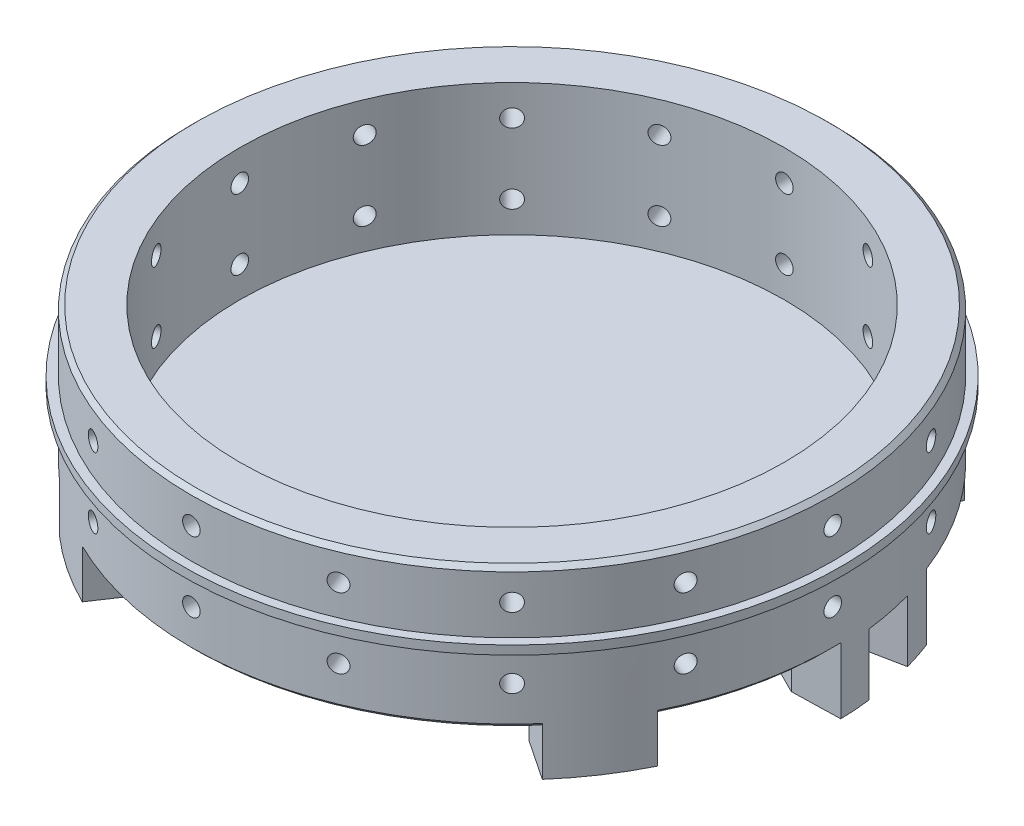
from build123d import *
from build123d.topology import SkipClean

# Parameters (mm, degrees)
RIPETIZIONECIRCOLARE7_COUNT = 16
CIRPATTERN1_COUNT           = 16
SKETCH7_R                   = 62
CUT_EXTRUDE4_DEPTH          = 108.266024459
BOSS_EXTRUDE20_START        = 2
SKETCH8_R                   = 73
BOSS_EXTRUDE20_DEPTH        = 2
BOSS_EXTRUDE19_START        = 14
BOSS_EXTRUDE19_DEPTH        = 14
CUT_EXTRUDE3_DEPTH          = 14
CIRPATTERN2_COUNT           = 2
BOSS_EXTRUDE21_START        = 10
BOSS_EXTRUDE21_DEPTH        = 10
CIRPATTERN3_COUNT           = 4
SMUSSO3_SIZE                = 1
CHAMFER1_SIZE               = 1


with BuildPart() as part:
    # Schizzo1 → Rivoluzione1 (revolve)
    with BuildSketch(Plane.XY, mode=Mode.PRIVATE) as rivoluzione1_sk:
        Polygon((-62, 30), (-73, 30), (-73, 16), (-75, 16), (-75, 14), (-73, 14), (-73, 0), (-62, 0), (-62, 14), (0, 14), (0, 16), (-62, 16), align=None)
    revolve(rivoluzione1_sk.sketch.rotate(Axis((0, 0, 0), (0, 1, 0)), 270), axis=Axis((0, 0, 0), (0, 1, 0)))

    # Schizzo5 → Ø4.0 (4) Diameter Hole1 (revolve, cut)
    with BuildSketch(Plane(origin=(-73, 23, 0), x_dir=(0, 0, 1), z_dir=(0, 1, 0))):
        Polygon((0, 0), (0, 19), (2, 17.798278762), (2, 0), align=None)
    f_4_0_4_diameter_hole1 = revolve(axis=Axis((-79.35, 23, 0), (1, 0, 0)), mode=Mode.SUBTRACT)

    # Schizzo9 → Foro Ø4.0 (4)-3 (revolve, cut)
    with BuildSketch(Plane(origin=(73, 7, 0), x_dir=(0, 0, -1), z_dir=(0, 1, 0))):
        Polygon((0, 0), (0, 19), (2, 17.798278762), (2, 0), align=None)
    foro_4_0_4_3 = revolve(axis=Axis((79.35, 7, 0), (-1, 0, 0)), mode=Mode.SUBTRACT)

    # RipetizioneCircolare7: Foro Ø4.0 (4)-3 ×16 about axis
    ripetizionecircolare7_axis = Axis((0, 14, 0), (0, -1, 0))
    for i in range(1, RIPETIZIONECIRCOLARE7_COUNT):
        add(foro_4_0_4_3.rotate(ripetizionecircolare7_axis, i * 360 / RIPETIZIONECIRCOLARE7_COUNT), mode=Mode.SUBTRACT)

    # CirPattern1: Ø4.0 (4) Diameter Hole1 ×16 about axis
    cirpattern1_axis = Axis((0, 16, 0), (0, -1, 0))
    for i in range(1, CIRPATTERN1_COUNT):
        add(f_4_0_4_diameter_hole1.rotate(cirpattern1_axis, i * 360 / CIRPATTERN1_COUNT), mode=Mode.SUBTRACT)

    # Sketch7 → Cut-Extrude4 (cut, through all)
    with BuildSketch(Plane.XZ.offset(-14)):
        with Locations(Location((0, 0, 0), (0, 0, 270))):
            Circle(SKETCH7_R)
    extrude(amount=-CUT_EXTRUDE4_DEPTH, mode=Mode.SUBTRACT)

    # Sketch8 → Boss-Extrude20 (add)
    with BuildSketch(Plane.XZ.offset(BOSS_EXTRUDE20_START)):
        with Locations(Location((0, 0, 0), (0, 0, 270))):
            Circle(SKETCH8_R)
    extrude(amount=-BOSS_EXTRUDE20_DEPTH)

    # Sketch6 → Boss-Extrude19 (add)
    with SkipClean():  # the faces are left unmerged after this step: merging them gives an invalid solid
        with BuildSketch(Plane.XZ.offset(2).offset(BOSS_EXTRUDE19_START)):
            with BuildLine():
                Line((-72.976985448, 1.832919783), (-61.980453394, 1.556726391))
                Line((-61.980453394, 1.556726391), (-53.695669228, 5.701108242))
                ThreePointArc((-53.695669228, 5.701108242), (-52.959930681, 10.534385188), (-51.790049455, 15.281305786))
                Line((-51.790049455, 15.281305786), (-57.858205705, 22.280664994))
                Line((-57.858205705, 22.280664994), (-68.123371233, 26.233686203))
                ThreePointArc((-68.123371233, 26.233686203), (-71.597325469, 14.241593507), (-72.976985448, 1.832919783))
            make_face()
        boss_extrude19 = extrude(amount=-BOSS_EXTRUDE19_DEPTH)

    # Sketch3 → Cut-Extrude3 (cut)
    with SkipClean():  # the faces are left unmerged after this step: merging them gives an invalid solid
        with BuildSketch(Plane.XZ.offset(16)):
            with BuildLine():
                Line((-61.555918543, 7.036415348), (-59.562972824, 17.055630068))
                Line((-59.562972824, 17.055630068), (-59.955820303, 17.643567869))
                Line((-59.955820303, 17.643567869), (-70.291743966, 19.699510914))
                ThreePointArc((-70.291743966, 19.699510914), (-71.597325469, 14.241593507), (-72.479780007, 8.699510914))
                Line((-72.479780007, 8.699510914), (-62.143856344, 6.643567869))
                Line((-62.143856344, 6.643567869), (-61.555918543, 7.036415348))
            make_face()
        cut_extrude3 = extrude(amount=-CUT_EXTRUDE3_DEPTH, mode=Mode.SUBTRACT)

    # Sketch4 → Ø4.0 (4) Diameter Hole3 (revolve, cut)
    with SkipClean():  # the faces are left unmerged after this step: merging them gives an invalid solid
        with BuildSketch(Plane(origin=(-60.559445683, -9, 12.046022708), x_dir=(0.19509032201612725, 0, 0.9807852804032307), z_dir=(0, 1, 0))):
            Polygon((0, 0), (0, 19), (2, 17.798278762), (2, 0), align=None)
        f_4_0_4_diameter_hole3 = revolve(axis=Axis((-66.787432214, -9, 13.284846253), (0.9807852804032307, 0, -0.19509032201612722)), mode=Mode.SUBTRACT)

    # CirPattern2: Boss-Extrude19, Cut-Extrude3, Ø4.0 (4) Diameter Hole3 ×2 about axis
    with SkipClean():  # the faces are left unmerged after this step: merging them gives an invalid solid
        cirpattern2_axis = Axis((0, 0, 0), (0, 1, 0))
        add([boss_extrude19.rotate(cirpattern2_axis, i * 360 / CIRPATTERN2_COUNT) for i in range(1, CIRPATTERN2_COUNT)])
        add([cut_extrude3.rotate(cirpattern2_axis, i * 360 / CIRPATTERN2_COUNT) for i in range(1, CIRPATTERN2_COUNT)], mode=Mode.SUBTRACT)
        add([f_4_0_4_diameter_hole3.rotate(cirpattern2_axis, i * 360 / CIRPATTERN2_COUNT) for i in range(1, CIRPATTERN2_COUNT)], mode=Mode.SUBTRACT)

    # Sketch9 → Boss-Extrude21 (add)
    with SkipClean():  # the faces are left unmerged after this step: merging them gives an invalid solid
        with BuildSketch(Plane.XZ.offset(2).offset(BOSS_EXTRUDE21_START)):
            with BuildLine():
                Line((-39.284747919, 58.793780121), (-26.201666203, 56.191393364))
                Line((-26.201666203, 56.191393364), (-32.37391347, 65.428814193))
                ThreePointArc((-32.37391347, 65.428814193), (-40.55662701, 60.697281698), (-48.059381943, 54.948119233))
                Line((-48.059381943, 54.948119233), (-41.887134676, 45.710698404))
                Line((-41.887134676, 45.710698404), (-39.284747919, 58.793780121))
            make_face()
        boss_extrude21 = extrude(amount=-BOSS_EXTRUDE21_DEPTH)

    # CirPattern3: Boss-Extrude21 ×4 about axis
    with SkipClean():  # the faces are left unmerged after this step: merging them gives an invalid solid
        cirpattern3_axis = Axis((0, 0, 0), (0, 1, 0))
        for i in range(1, CIRPATTERN3_COUNT):
            add(boss_extrude21.rotate(cirpattern3_axis, i * 360 / CIRPATTERN3_COUNT))

    # Smusso3
    smusso3_edges = [part.edges().sort_by_distance(p)[0] for p in [
        (0, 30, 73),
    ]]
    chamfer(smusso3_edges, length=SMUSSO3_SIZE)

    # Chamfer1
    # the kernel refuses this chamfer: 1 mm, written as the material it takes off along each edge
    with BuildSketch(Plane(origin=(0, -2, 0), x_dir=(-0.999684732163714, 0, 0.025108490172915592), z_dir=(0.025108490172915592, 0, 0.999684732163714))) as chamfer1_piece_1_section:
        Polygon((73, -CHAMFER1_SIZE), (73 - CHAMFER1_SIZE, 0), (73, 0), align=None)
    chamfer1_piece_1 = revolve(axis=Axis((0, -2, 0), (0, -1, 0)), revolution_arc=29.783304933, mode=Mode.PRIVATE)
    chamfer1_piece_1 = split(chamfer1_piece_1, bisect_by=Plane(origin=(-61.416959593, -1.518984414, -29.693277928), z_dir=(-0.5555702330196065, 0, 0.8314696123025425)), keep=Keep.TOP, mode=Mode.PRIVATE)
    add(chamfer1_piece_1, mode=Mode.SUBTRACT)
    with BuildSketch(Plane(origin=(0, -2, 0), x_dir=(0.999684732163714, 0, -0.025108490172915474), z_dir=(-0.025108490172915474, 0, -0.999684732163714))) as chamfer1_piece_2_section:
        Polygon((73, -CHAMFER1_SIZE), (73 - CHAMFER1_SIZE, 0), (73, 0), align=None)
    chamfer1_piece_2 = revolve(axis=Axis((0, -2, 0), (0, -1, 0)), revolution_arc=29.783304933, mode=Mode.PRIVATE)
    chamfer1_piece_2 = split(chamfer1_piece_2, bisect_by=Plane(origin=(61.416959593, -1.518984414, 29.693277928), z_dir=(0.5555702330196064, 0, -0.8314696123025425)), keep=Keep.TOP, mode=Mode.PRIVATE)
    add(chamfer1_piece_2, mode=Mode.SUBTRACT)
    with BuildSketch(Plane(origin=(0, -2, 0), x_dir=(-0.6314266499321265, 0, 0.7754356103220252), z_dir=(0.7754356103220252, 0, 0.6314266499321265))) as chamfer1_piece_3_section:
        Polygon((73, -CHAMFER1_SIZE), (73 - CHAMFER1_SIZE, 0), (73, 0), align=None)
    chamfer1_piece_3 = revolve(axis=Axis((0, -2, 0), (0, -1, 0)), revolution_arc=29.783304933, mode=Mode.PRIVATE)
    chamfer1_piece_3 = split(chamfer1_piece_3, bisect_by=Plane(origin=(-45.378746401, -1.518984414, 50.936264633), z_dir=(-0.8314696123025437, 0, -0.5555702330196046)), keep=Keep.TOP, mode=Mode.PRIVATE)
    add(chamfer1_piece_3, mode=Mode.SUBTRACT)
    with BuildSketch(Plane(origin=(0, -2, 0), x_dir=(-0.7754373895365837, 0, -0.6314244649272696), z_dir=(-0.6314244649272696, 0, 0.7754373895365837))) as chamfer1_piece_4_section:
        Polygon((73, -CHAMFER1_SIZE), (73 - CHAMFER1_SIZE, 0), (73, 0), align=None)
    chamfer1_piece_4 = revolve(axis=Axis((0, -2, 0), (0, -1, 0)), revolution_arc=50.844704661, mode=Mode.PRIVATE)
    chamfer1_piece_4 = split(chamfer1_piece_4, bisect_by=Plane(origin=(-45.988972108, -1.522918833, -42.073071221), z_dir=(0.5555702330196048, 0, -0.8314696123025436)), keep=Keep.TOP, mode=Mode.PRIVATE)
    add(chamfer1_piece_4, mode=Mode.SUBTRACT)
    with BuildSketch(Plane(origin=(0, -2, 0), x_dir=(0.6314266499321266, 0, -0.7754356103220251), z_dir=(-0.7754356103220251, 0, -0.6314266499321266))) as chamfer1_piece_5_section:
        Polygon((73, -CHAMFER1_SIZE), (73 - CHAMFER1_SIZE, 0), (73, 0), align=None)
    chamfer1_piece_5 = revolve(axis=Axis((0, -2, 0), (0, -1, 0)), revolution_arc=29.783304933, mode=Mode.PRIVATE)
    chamfer1_piece_5 = split(chamfer1_piece_5, bisect_by=Plane(origin=(45.378746401, -1.518984414, -50.936264633), z_dir=(0.8314696123025436, 0, 0.5555702330196047)), keep=Keep.TOP, mode=Mode.PRIVATE)
    add(chamfer1_piece_5, mode=Mode.SUBTRACT)
    with BuildSketch(Plane(origin=(0, -2, 0), x_dir=(0.7754409900885828, 0, 0.6314200431491215), z_dir=(0.6314200431491215, 0, -0.7754409900885828))) as chamfer1_piece_6_section:
        Polygon((73, -CHAMFER1_SIZE), (73 - CHAMFER1_SIZE, 0), (73, 0), align=None)
    chamfer1_piece_6 = revolve(axis=Axis((0, -2, 0), (0, -1, 0)), revolution_arc=79.190062756, mode=Mode.PRIVATE)
    chamfer1_piece_6 = split(chamfer1_piece_6, bisect_by=Plane(origin=(-20.649102806, -1.526460144, 47.881394987), z_dir=(0.8314696123025426, 0, 0.5555702330196063)), keep=Keep.TOP, mode=Mode.PRIVATE)
    chamfer1_piece_6 = split(chamfer1_piece_6, bisect_by=Plane(origin=(37.400700027, -1.526460144, 36.334571279), z_dir=(-0.5555702330196047, 0, 0.8314696123025436)), keep=Keep.TOP, mode=Mode.PRIVATE)
    add(chamfer1_piece_6, mode=Mode.SUBTRACT)
    with BuildSketch(Plane(origin=(0, -2, 0), x_dir=(0, 0, -1), z_dir=(-1, 0, 0))) as chamfer1_piece_7_section:
        Polygon((73, -CHAMFER1_SIZE), (73 - CHAMFER1_SIZE, 0), (73, 0), align=None)
    chamfer1_piece_7 = revolve(axis=Axis((0, -2, 0), (0, -1, 0)), revolution_arc=28.344535426, mode=Mode.PRIVATE)
    chamfer1_piece_7 = split(chamfer1_piece_7, bisect_by=Plane(origin=(29.873934044, -1.518650244, -61.687330578), z_dir=(-0.8314696123025425, 0, -0.5555702330196064)), keep=Keep.TOP, mode=Mode.PRIVATE)
    add(chamfer1_piece_7, mode=Mode.SUBTRACT)


solid = part.part
